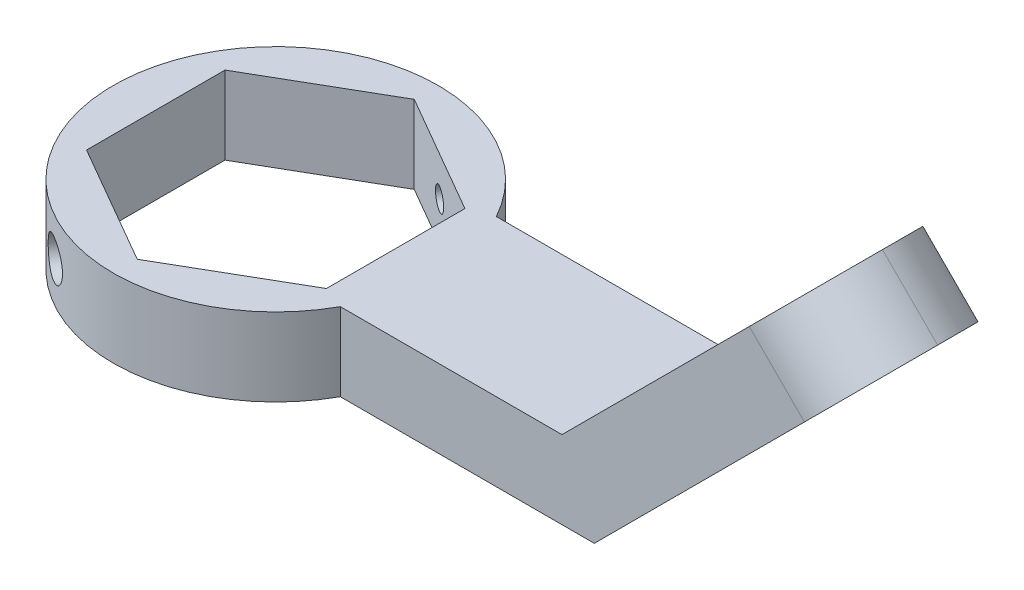
from build123d import *

# Parameters (mm, degrees)
BOSS_EXTRUDE1_DEPTH = 12
SKETCH4_W           = 57.71930009
SKETCH4_H           = 24
SKETCH4_R           = 4
BOSS_EXTRUDE2_DEPTH = 12
SKETCH4_3_R         = 8
SKETCH4_3_R_2       = 4
CUT_EXTRUDE1_DEPTH  = 5.15
FILLET1_R           = 12
SKETCH5_R           = 1.7
CUT_EXTRUDE2_DEPTH  = 113.615583531
CUT_EXTRUDE3_START  = -5
SKETCH5_3_R         = 3
CUT_EXTRUDE3_DEPTH  = 108.615583567


with BuildPart() as part:
    # Sketch3 → Boss-Extrude1 (new body)
    with BuildSketch(Plane(origin=(0, 0, 0), x_dir=(1, 0, 0), z_dir=(0, 1, 0))):
        with BuildLine():
            ThreePointArc((21.931712199, 12), (-25, 0), (21.931712199, -12))
            Line((21.931712199, -12), (61, -12))
            Line((61, -12), (61, 12))
            Line((61, 12), (21.931712199, 12))
        make_face()
        Polygon((-18.45, 10.652112467), (0, 21.304224933), (18.45, 10.652112467), (18.45, -10.652112467), (0, -21.304224933), (-18.45, -10.652112467), align=None, mode=Mode.SUBTRACT)
    extrude(amount=BOSS_EXTRUDE1_DEPTH)

    # Sketch4 → Boss-Extrude2 (add)
    with BuildSketch(Plane(origin=(30.5, -30.5, 0), x_dir=(0.7071067811865462, 0.7071067811865489, 0), z_dir=(0.7071067811865489, -0.7071067811865462, 0))):
        with Locations((71.993163697, 0)):
            Rectangle(SKETCH4_W, SKETCH4_H)
        with Locations((84.852813742, 0)):
            Circle(SKETCH4_R, mode=Mode.SUBTRACT)
    extrude(amount=-BOSS_EXTRUDE2_DEPTH)

    # Sketch4<3> → Cut-Extrude1 (cut)
    with BuildSketch(Plane(origin=(30.5, -30.5, 0), x_dir=(0.7071067811865462, 0.7071067811865489, 0), z_dir=(0.7071067811865489, -0.7071067811865462, 0))):
        with Locations((84.852813742, 0)):
            Circle(SKETCH4_3_R)
        with Locations((84.852813742, 0)):
            Circle(SKETCH4_3_R_2, mode=Mode.SUBTRACT)
    extrude(amount=-CUT_EXTRUDE1_DEPTH, mode=Mode.SUBTRACT)

    # Fillet1
    fillet1_edges = [part.edges().sort_by_distance(p)[0] for p in [
        (97.571067812, 45.056349186, -12),
        (97.571067812, 45.056349186, 12),
    ]]
    fillet(fillet1_edges, radius=FILLET1_R - 0.0001)  # a hair under: the kernel refuses the full size

    # Sketch5 → Cut-Extrude2 (cut, through all)
    with BuildSketch(Plane(origin=(9.225, 0, -15.9781687), x_dir=(0.8660254037844388, 0, 0.4999999999999997), z_dir=(-0.49999999999999983, 0, 0.8660254037844389))):
        with Locations((0, 6)):
            Circle(SKETCH5_R)
    cut_extrude2 = extrude(amount=-CUT_EXTRUDE2_DEPTH, mode=Mode.SUBTRACT)

    # Sketch5<3> → Cut-Extrude3 (cut, through all)
    with BuildSketch(Plane(origin=(9.225, 0, -15.9781687), x_dir=(0.8660254037844388, 0, 0.4999999999999997), z_dir=(-0.49999999999999983, 0, 0.8660254037844389)).offset(CUT_EXTRUDE3_START)):
        with Locations((0, 6)):
            Circle(SKETCH5_3_R)
    cut_extrude3 = extrude(amount=-CUT_EXTRUDE3_DEPTH, mode=Mode.SUBTRACT)

    # Mirror1: Cut-Extrude2, Cut-Extrude3 across plane
    add(cut_extrude2.mirror(Plane(origin=(0, 0, 0), x_dir=(0.866025403784439, 0, 0.4999999999999995), z_dir=(-0.49999999999999994, 0, 0.8660254037844388))), mode=Mode.SUBTRACT)
    add(cut_extrude3.mirror(Plane(origin=(0, 0, 0), x_dir=(0.866025403784439, 0, 0.4999999999999995), z_dir=(-0.49999999999999994, 0, 0.8660254037844388))), mode=Mode.SUBTRACT)


solid = part.part
